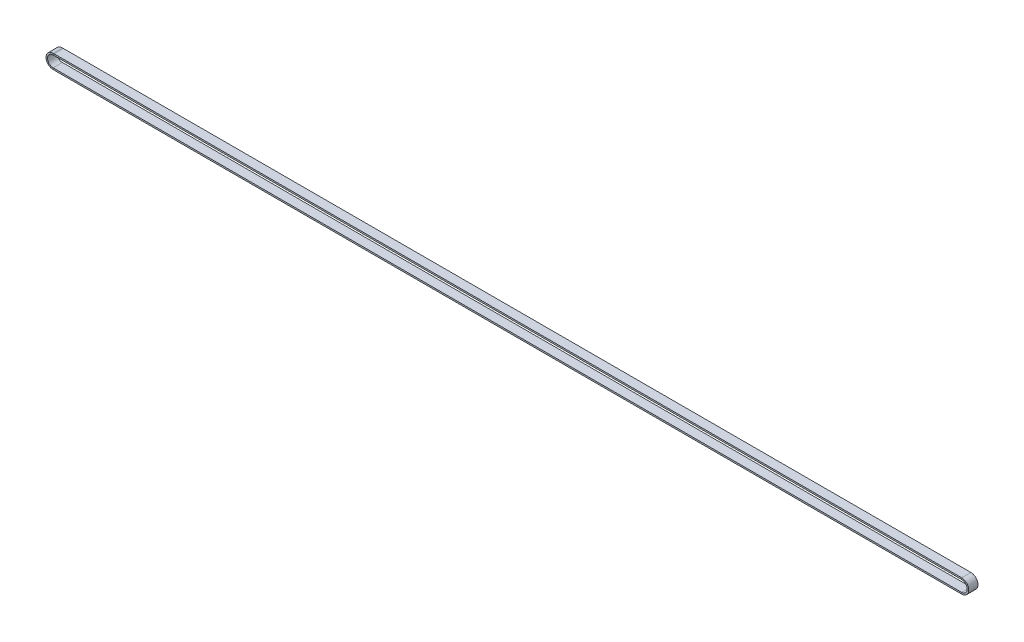
from build123d import *

# Parameters (mm, degrees)
SKETCH3_W = 9
SKETCH3_H = 1.5


with BuildPart() as part:
    # Sweep1: sweep along a path in Sketch2
    with BuildLine(Plane.XY.offset(-34.983366658)) as sweep1_path:
        Line((-1, -57.890227813), (883.520637828, -57.890227813))
        ThreePointArc((883.520637828, -57.890227813), (890.420637828, -64.790227813), (883.520637828, -71.690227813))
        Line((883.520637828, -71.690227813), (-1, -71.690227813))
        ThreePointArc((-1, -71.690227813), (-7.9, -64.790227813), (-1, -57.890227813))
    # Sketch3 → Sweep1 (sweep)
    with BuildSketch(Plane(origin=(0, 0, 0), x_dir=(0, 0, -1), z_dir=(1, 0, 0))):
        with Locations((30.483366658, -58.640227813)):
            Rectangle(SKETCH3_W, SKETCH3_H)
    sweep(path=sweep1_path.line)


solid = part.part
